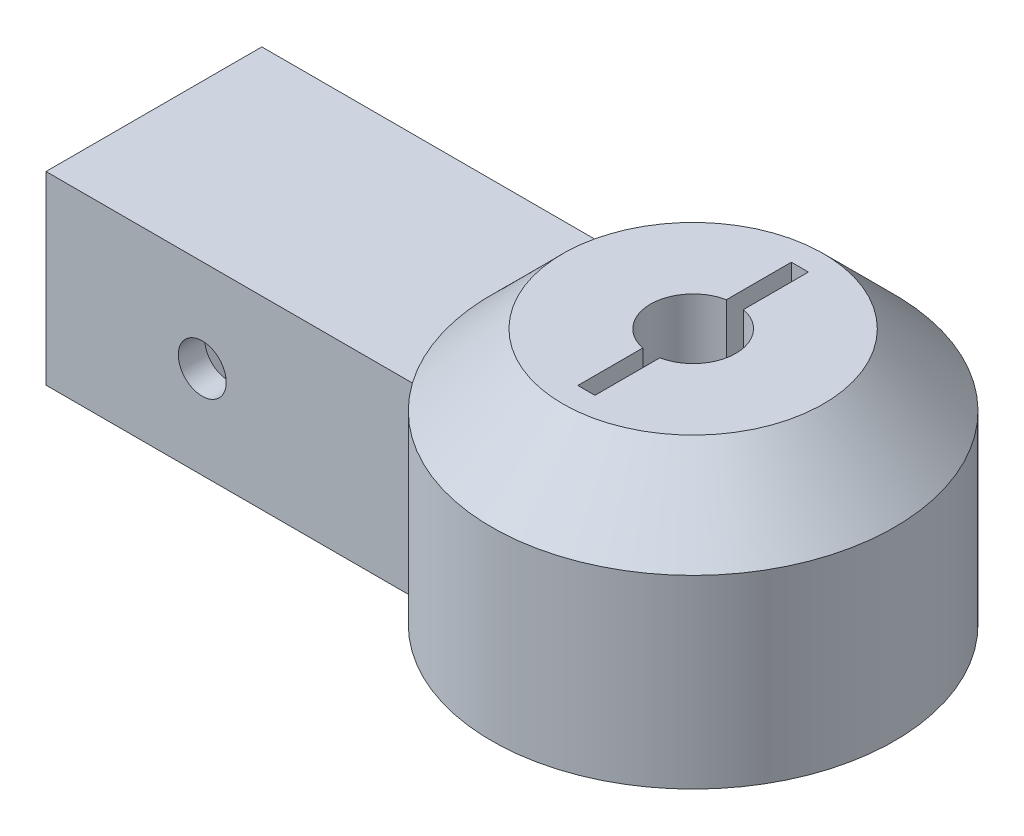
from build123d import *

# Parameters (mm, degrees)
ESBO_O2_R                = 11.15
RESSALTO_EXTRUS_O1_DEPTH = 13
ESBO_O3_W                = 7
ESBO_O3_H                = 7
CORTE_EXTRUS_O1_DEPTH    = 26
CORTE_EXTRUS_O2_DEPTH    = 2.8
ESBO_O10_R               = 1.683661958
CORTE_EXTRUS_O3_DEPTH    = 2.8
ESBO_O11_R               = 14.15
RESSALTO_EXTRUS_O2_DEPTH = 5
CHANFRO1_SIZE            = 5


with BuildPart() as part:
    # Esboço2 → Ressalto-extrusão1 (new body)
    with BuildSketch(Plane(origin=(0, 0, 0), x_dir=(1, 0, 0), z_dir=(0, 1, 0))):
        with BuildLine():
            Line((-12.297255791, 7), (-37.297255791, 7))
            Line((-37.297255791, 7), (-37.297255791, -8.161034979))
            Line((-37.297255791, -8.161034979), (-11.559412099, -8.161034979))
            ThreePointArc((-11.559412099, -8.161034979), (14.133272661, 0.687825475), (-12.297255791, 7))
        make_face()
        with Locations(Location((0, 0, 0), (0, 0, 90))):
            Circle(ESBO_O2_R, mode=Mode.SUBTRACT)
    extrude(amount=RESSALTO_EXTRUS_O1_DEPTH)

    # Esboço3 → Corte-extrusão1 (cut)
    with BuildSketch(Plane.ZY.offset(37.297255791)):
        with Locations((0, 6.5)):
            Rectangle(ESBO_O3_W, ESBO_O3_H)
    extrude(amount=-CORTE_EXTRUS_O1_DEPTH, mode=Mode.SUBTRACT)

    # Esboço7 → Corte-extrusão2 (cut)
    with BuildSketch(Plane(origin=(0, 0, 3.5), x_dir=(-1, 0, 0), z_dir=(0, 0, -1))):
        Polygon((22.62619922, 6.5), (24.473720081, 3.3), (28.168761804, 3.3), (30.016282665, 6.5), (28.168761804, 9.7), (24.473720081, 9.7), align=None)
    extrude(amount=-CORTE_EXTRUS_O2_DEPTH, mode=Mode.SUBTRACT)

    # Esboço10 → Corte-extrusão3 (cut)
    with BuildSketch(Plane(origin=(0, 0, 6.3), x_dir=(-1, 0, 0), z_dir=(0, 0, -1))):
        with Locations((26.321240942, 6.5)):
            Circle(ESBO_O10_R)
    extrude(amount=-CORTE_EXTRUS_O3_DEPTH, mode=Mode.SUBTRACT)

    # Esboço11 → Ressalto-extrusão2 (add)
    with BuildSketch(Plane(origin=(0, 13, 0), x_dir=(1, 0, 0), z_dir=(0, 1, 0))):
        with Locations(Location((0, 0, 0), (0, 0, 150.350053351))):
            Circle(ESBO_O11_R)
        with BuildLine():
            Line((0.6, -7.5), (0.6, -2.939387691))
            ThreePointArc((0.6, -2.939387691), (3, 0), (0.6, 2.939387691))
            Line((0.6, 2.939387691), (0.6, 7.5))
            Line((0.6, 7.5), (-0.6, 7.5))
            Line((-0.6, 7.5), (-0.6, 2.939387691))
            ThreePointArc((-0.6, 2.939387691), (-3, 0), (-0.6, -2.939387691))
            Line((-0.6, -2.939387691), (-0.6, -7.5))
            Line((-0.6, -7.5), (0.6, -7.5))
        make_face(mode=Mode.SUBTRACT)
    extrude(amount=RESSALTO_EXTRUS_O2_DEPTH)

    # Chanfro1
    chanfro1_edges = [part.edges().sort_by_distance(p)[0] for p in [
        (12.297255791, 18, 7),
    ]]
    chamfer(chanfro1_edges, length=CHANFRO1_SIZE - 0.0001)  # a hair under: the kernel refuses the full size


solid = part.part
